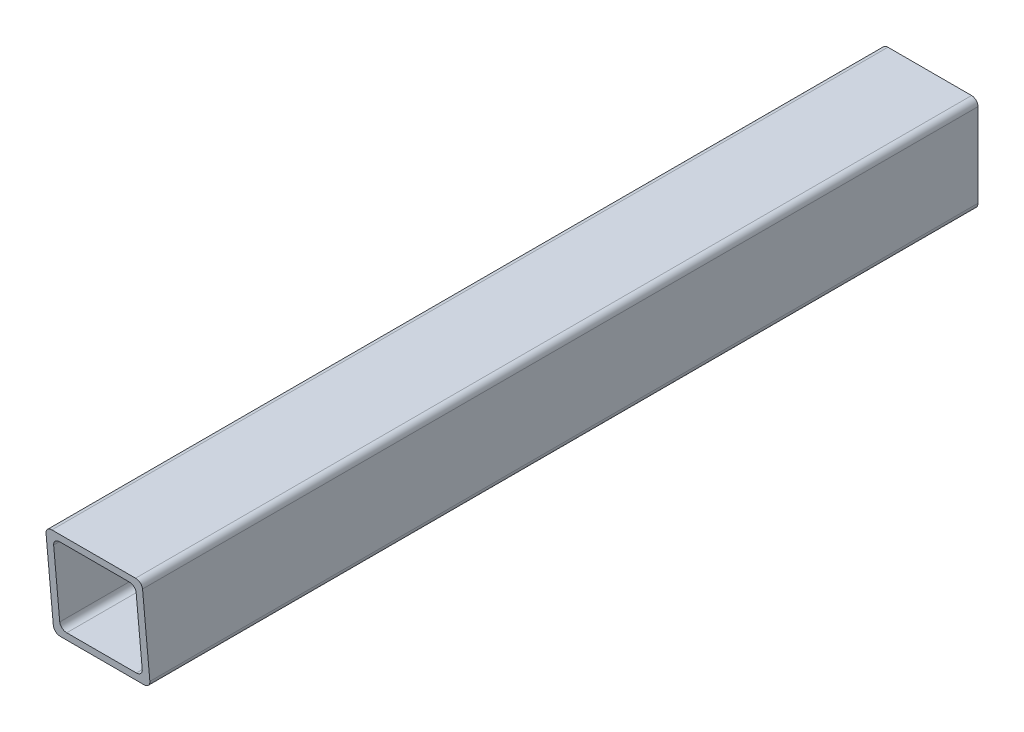
from build123d import *

# Parameters (mm, degrees)
BOSS_EXTRUDE1_DEPTH = 330
CUT_EXTRUDE1_DEPTH  = 335.369885008


with BuildPart() as part:
    # Sketch1 → Boss-Extrude1 (new body)
    with BuildSketch(Plane.XY):
        with BuildLine():
            Line((2.54, 0), (35.56, 0))
            ThreePointArc((35.56, 0), (37.356051224, -0.743948776), (38.1, -2.54))
            Line((38.1, -2.54), (38.1, -35.56))
            ThreePointArc((38.1, -35.56), (37.356051224, -37.356051224), (35.56, -38.1))
            Line((35.56, -38.1), (2.54, -38.1))
            ThreePointArc((2.54, -38.1), (0.743948776, -37.356051224), (0, -35.56))
            Line((0, -35.56), (0, -2.54))
            ThreePointArc((0, -2.54), (0.743948776, -0.743948776), (2.54, 0))
        make_face()
        with BuildLine():
            Line((5.3086, -2.7686), (32.7914, -2.7686))
            ThreePointArc((32.7914, -2.7686), (34.587451224, -3.512548776), (35.3314, -5.3086))
            Line((35.3314, -5.3086), (35.3314, -32.7914))
            ThreePointArc((35.3314, -32.7914), (34.587451224, -34.587451224), (32.7914, -35.3314))
            Line((32.7914, -35.3314), (5.3086, -35.3314))
            ThreePointArc((5.3086, -35.3314), (3.512548776, -34.587451224), (2.7686, -32.7914))
            Line((2.7686, -32.7914), (2.7686, -5.3086))
            ThreePointArc((2.7686, -5.3086), (3.512548776, -3.512548776), (5.3086, -2.7686))
        make_face(mode=Mode.SUBTRACT)
    extrude(amount=BOSS_EXTRUDE1_DEPTH)

    # Sketch2 → Cut-Extrude1 (cut, through all)
    with BuildSketch(Plane(origin=(38.1, 0, 0), x_dir=(0, 0, -1), z_dir=(1, 0, 0))):
        Polygon((-330, 0), (-326.66668192, -38.1), (-330, -38.1), align=None)
    extrude(amount=-CUT_EXTRUDE1_DEPTH, mode=Mode.SUBTRACT)


solid = part.part
